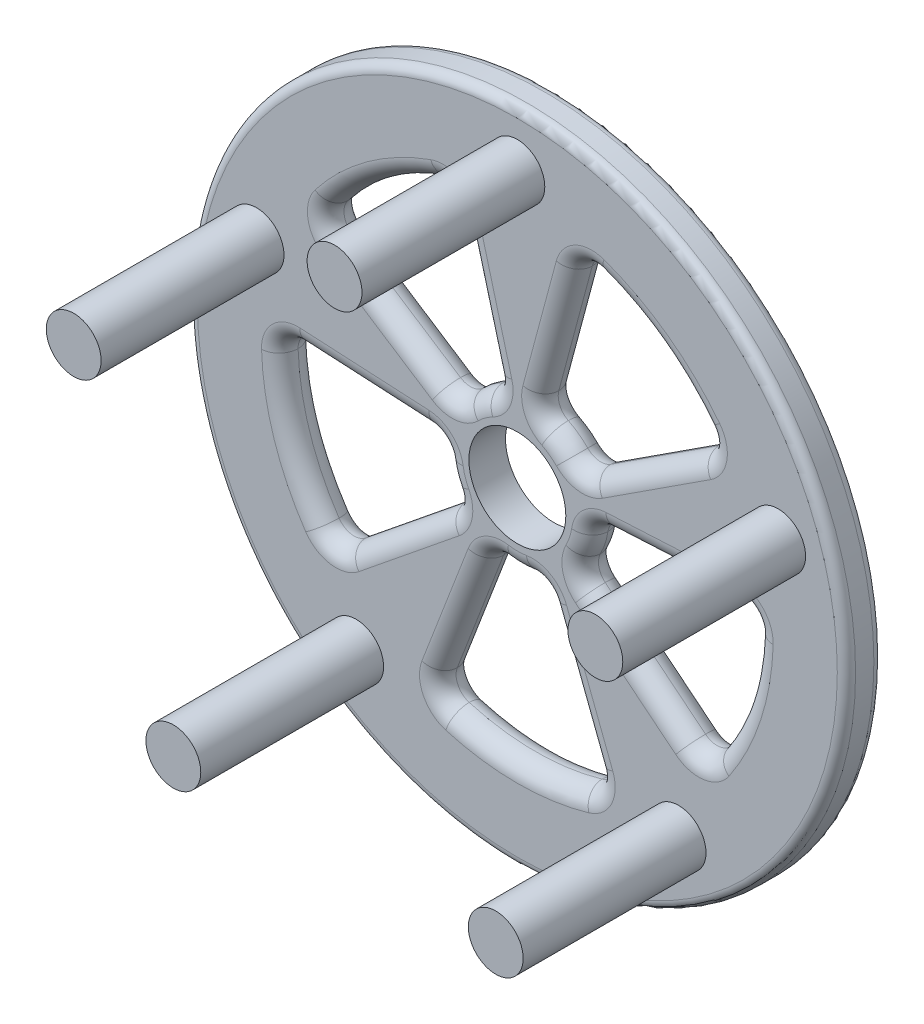
from build123d import *

# Parameters (mm, degrees)
SKETCH1_R           = 18
BOSS_EXTRUDE1_DEPTH = 2
FILLET1_R           = 1
FILLET2_R           = 0.5
SKETCH2_R           = 1.5
BOSS_EXTRUDE2_DEPTH = 10
SKETCH4_R           = 2.65
CUT_EXTRUDE1_DEPTH  = 2


with BuildPart() as part:
    # Sketch1 → Boss-Extrude1 (new body)
    with BuildSketch(Plane.XY):
        Circle(SKETCH1_R)
        with BuildLine():
            ThreePointArc((-4.658783344, -12.136545544), (0, -13), (4.658783344, -12.136545544))
            Line((4.658783344, -12.136545544), (1.433471798, -3.734321706))
            ThreePointArc((1.433471798, -3.734321706), (0, -4), (-1.433471798, -3.734321706))
            Line((-1.433471798, -3.734321706), (-4.658783344, -12.136545544))
        make_face(mode=Mode.SUBTRACT)
        with BuildLine():
            Line((-3.994518139, 0.209343825), (-12.982183952, 0.680367431))
            ThreePointArc((-12.982183952, 0.680367431), (-12.363734712, -4.017220927), (-10.102897499, -8.181165084))
            Line((-10.102897499, -8.181165084), (-3.108583846, -2.517281564))
            ThreePointArc((-3.108583846, -2.517281564), (-3.804226065, -1.236067977), (-3.994518139, 0.209343825))
        make_face(mode=Mode.SUBTRACT)
        with BuildLine():
            Line((-1.03527618, 3.863703305), (-3.364647586, 12.557035742))
            ThreePointArc((-3.364647586, 12.557035742), (-7.64120828, 10.517220927), (-10.902717383, 7.080307455))
            Line((-10.902717383, 7.080307455), (-3.354682272, 2.17855614))
            ThreePointArc((-3.354682272, 2.17855614), (-2.351141009, 3.236067977), (-1.03527618, 3.863703305))
        make_face(mode=Mode.SUBTRACT)
        with BuildLine():
            Line((3.354682272, 2.17855614), (10.902717383, 7.080307455))
            ThreePointArc((10.902717383, 7.080307455), (7.64120828, 10.517220927), (3.364647586, 12.557035742))
            Line((3.364647586, 12.557035742), (1.03527618, 3.863703305))
            ThreePointArc((1.03527618, 3.863703305), (2.351141009, 3.236067977), (3.354682272, 2.17855614))
        make_face(mode=Mode.SUBTRACT)
        with BuildLine():
            Line((3.108583846, -2.517281564), (10.102897499, -8.181165084))
            ThreePointArc((10.102897499, -8.181165084), (12.363734712, -4.017220927), (12.982183952, 0.680367431))
            Line((12.982183952, 0.680367431), (3.994518139, 0.209343825))
            ThreePointArc((3.994518139, 0.209343825), (3.804226065, -1.236067977), (3.108583846, -2.517281564))
        make_face(mode=Mode.SUBTRACT)
    extrude(amount=BOSS_EXTRUDE1_DEPTH)

    # Fillet1
    fillet1_edges = [part.edges().sort_by_distance(p)[0] for p in [
        (3.804226065, -1.236067977, 2),
        (8.488351045, 0.444855628, 2),
        (0, -13, 2),
        (12.363734712, -4.017220927, 2),
        (-3.046127571, -7.935433625, 2),
        (0, -4, 2),
        (12.363734712, -4.017220927, 0),
        (8.488351045, 0.444855628, 0),
        (3.046127571, -7.935433625, 2),
        (3.804226065, -1.236067977, 0),
        (6.605740672, -5.349223324, 0),
        (7.64120828, 10.517220927, 0),
        (2.199961883, 8.210369523, 0),
        (2.351141009, 3.236067977, 0),
        (7.128699828, 4.629431798, 0),
        (-7.64120828, 10.517220927, 0),
        (-7.128699828, 4.629431798, 0),
        (-2.351141009, 3.236067977, 0),
        (-2.199961883, 8.210369523, 0),
        (-12.363734712, -4.017220927, 0),
        (-6.605740672, -5.349223324, 0),
        (-3.804226065, -1.236067977, 0),
        (-8.488351045, 0.444855628, 0),
        (3.046127571, -7.935433625, 0),
        (0, -4, 0),
        (-3.046127571, -7.935433625, 0),
        (0, -13, 0),
        (-8.488351045, 0.444855628, 2),
        (-3.804226065, -1.236067977, 2),
        (10.102897499, -8.181165084, 1),
        (12.982183952, 0.680367431, 1),
        (3.994518139, 0.209343825, 1),
        (3.108583846, -2.517281564, 1),
        (10.902717383, 7.080307455, 1),
        (3.364647586, 12.557035742, 1),
        (1.03527618, 3.863703305, 1),
        (3.354682272, 2.17855614, 1),
        (-3.364647586, 12.557035742, 1),
        (-10.902717383, 7.080307455, 1),
        (-3.354682272, 2.17855614, 1),
        (-1.03527618, 3.863703305, 1),
        (-12.982183952, 0.680367431, 1),
        (-10.102897499, -8.181165084, 1),
        (-3.108583846, -2.517281564, 1),
        (-3.994518139, 0.209343825, 1),
        (4.658783344, -12.136545544, 1),
        (1.433471798, -3.734321706, 1),
        (-1.433471798, -3.734321706, 1),
        (-4.658783344, -12.136545544, 1),
        (-6.605740672, -5.349223324, 2),
        (-12.363734712, -4.017220927, 2),
        (-2.199961883, 8.210369523, 2),
        (-2.351141009, 3.236067977, 2),
        (-7.128699828, 4.629431798, 2),
        (-7.64120828, 10.517220927, 2),
        (7.128699828, 4.629431798, 2),
        (2.351141009, 3.236067977, 2),
        (2.199961883, 8.210369523, 2),
        (7.64120828, 10.517220927, 2),
        (6.605740672, -5.349223324, 2),
    ]]
    fillet(fillet1_edges, radius=FILLET1_R - 0.0001)  # a hair under: the kernel refuses the full size

    # Fillet2
    fillet2_edges = [part.edges().sort_by_distance(p)[0] for p in [
        (-18, 0, 2),
        (-18, 0, 0),
    ]]
    fillet(fillet2_edges, radius=FILLET2_R)

    # Sketch2 → Boss-Extrude2 (add)
    with BuildSketch(Plane.XY.offset(2)):
        with Locations((0, 15)):
            Circle(SKETCH2_R)
        with Locations((14.265847744, 4.635254916)):
            Circle(SKETCH2_R)
        with Locations((8.816778784, -12.135254916)):
            Circle(SKETCH2_R)
        with Locations((-8.816778784, -12.135254916)):
            Circle(SKETCH2_R)
        with Locations((-14.265847744, 4.635254916)):
            Circle(SKETCH2_R)
    extrude(amount=BOSS_EXTRUDE2_DEPTH)

    # Sketch4 → Cut-Extrude1 (cut)
    with BuildSketch(Plane(origin=(0, 0, 0), x_dir=(-1, 0, 0), z_dir=(0, 0, -1))):
        Circle(SKETCH4_R)
    extrude(amount=-CUT_EXTRUDE1_DEPTH, mode=Mode.SUBTRACT)


solid = part.part
